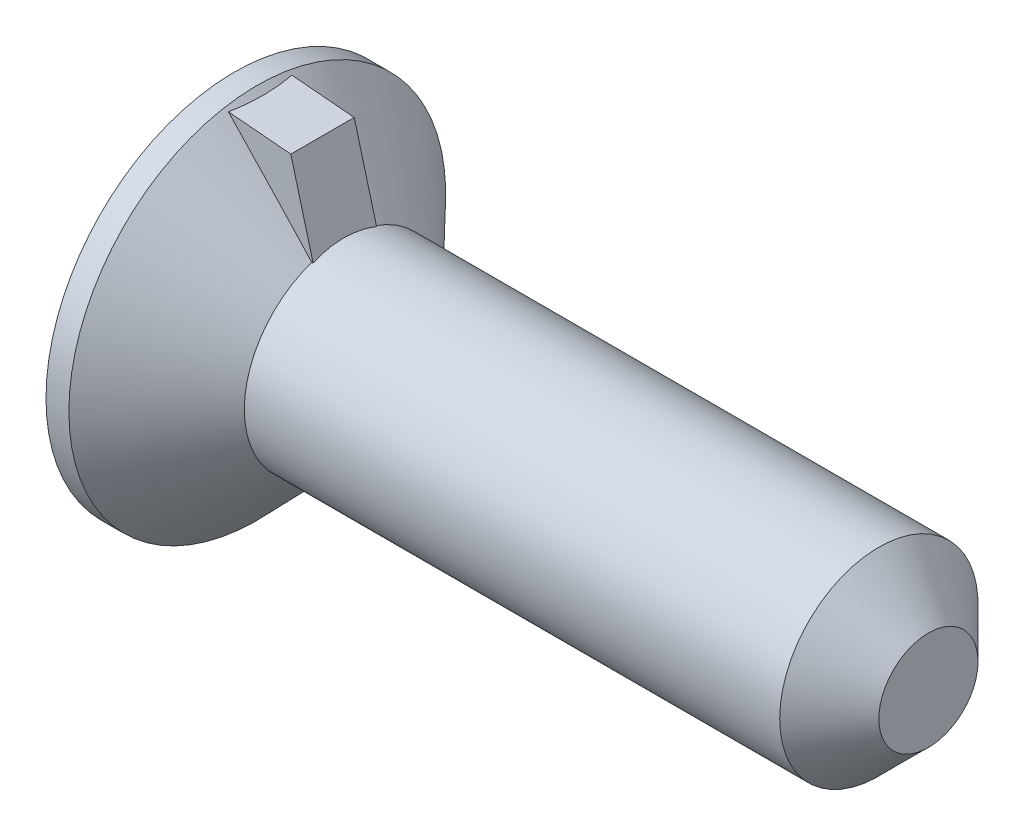
from build123d import *

# Parameters (mm, degrees)
NIB_DEPTH = 1.6


with BuildPart() as part:
    # BodySke → BaseBody (revolve)
    with BuildSketch(Plane.XY):
        Polygon((0, 0), (0, 9.5), (1.154400513, 9.5), (5.5, 5), (32.5, 5), (35, 2.5), (35, 0), align=None)
    revolve(axis=Axis((0, 0, 0), (1, 0, 0)))

    # NibSke → Nib (add, symmetric)
    with BuildSketch(Plane.XY):
        Polygon((4.444960958, 8.937459311), (6.839745962, 0), (1.154400513, 0), (1.154400513, 9.225346046), align=None)
    extrude(amount=NIB_DEPTH, both=True)


solid = part.part
